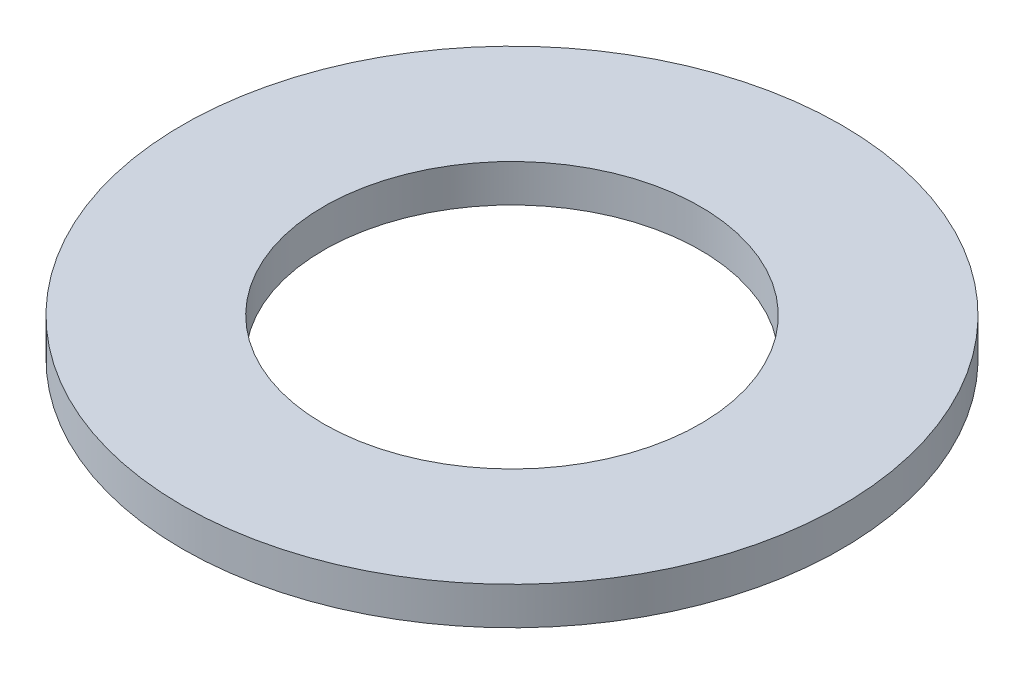
from build123d import *

# Parameters (mm, degrees)
SKETCH1_R           = 52.5
BOSS_EXTRUDE1_DEPTH = 6
SKETCH2_R           = 30
CUT_EXTRUDE1_DEPTH  = 75.488254108


with BuildPart() as part:
    # Sketch1 → Boss-Extrude1 (new body)
    with BuildSketch(Plane(origin=(0, 0, 0), x_dir=(1, 0, 0), z_dir=(0, 1, 0))):
        Circle(SKETCH1_R)
    extrude(amount=BOSS_EXTRUDE1_DEPTH)

    # Sketch2 → Cut-Extrude1 (cut, through all)
    with BuildSketch(Plane(origin=(0, 0, 0), x_dir=(1, 0, 0), z_dir=(0, 1, 0))):
        Circle(SKETCH2_R)
    extrude(amount=CUT_EXTRUDE1_DEPTH, mode=Mode.SUBTRACT)


solid = part.part
